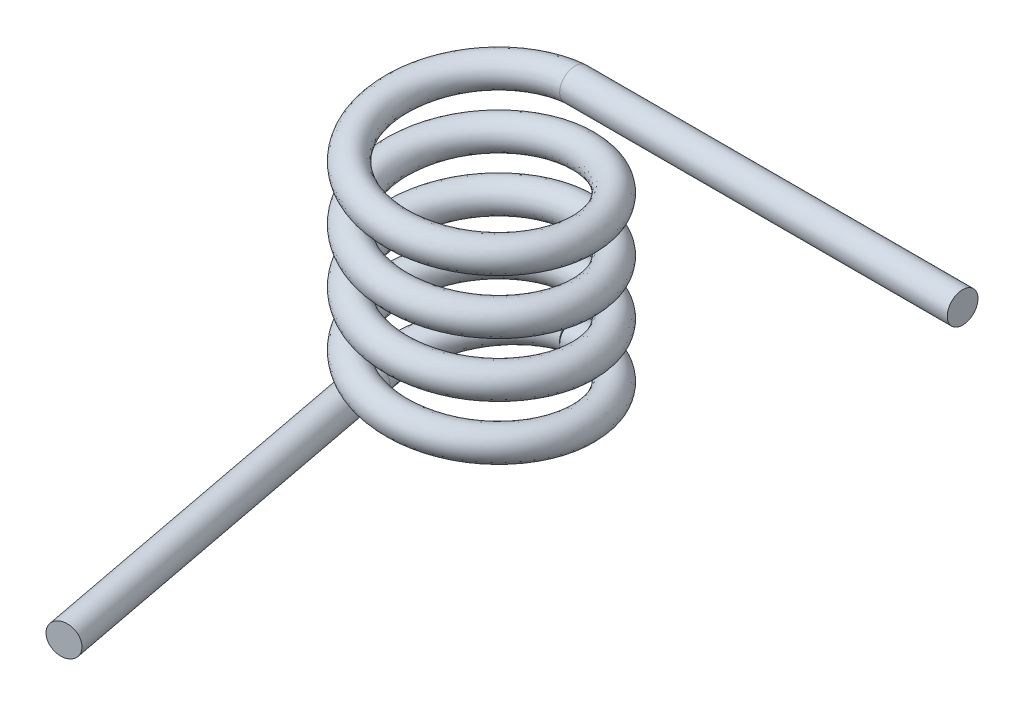
from build123d import *

# Parameters (mm, degrees)
SWEEP1_PITCH        = 1.125
SWEEP1_HEIGHT       = 4.5
SWEEP1_RADIUS       = 2
SWEEP1_START_ANGLE  = -180
SKETCH2_R           = 0.317499998
SWEEP3_PITCH        = 2.1875
SWEEP3_HEIGHT       = 0.6125
SWEEP3_RADIUS       = 2.25
SKETCH5_R           = 0.3175
SKETCH12_R          = 0.317499998
BOSS_EXTRUDE4_DEPTH = 8
SKETCH15_R          = 0.3175
BOSS_EXTRUDE7_DEPTH = 8


with BuildPart() as part:
    # Sweep1: sweep along a helix
    with BuildLine() as sweep1_path:
        add(Helix(SWEEP1_PITCH, SWEEP1_HEIGHT, SWEEP1_RADIUS, center=(0, 0, 0), direction=(0, 1, 0), lefthand=True, mode=Mode.PRIVATE).rotate(Axis((0, 0, 0), (0, 1, 0)), SWEEP1_START_ANGLE))
    # Sketch2 → Sweep1 (sweep)
    with BuildSketch(Plane(origin=(0, 0, 0), x_dir=(0, 0, -1), z_dir=(1, 0, 0))):
        with Locations((-1.93233569, 0.515828248)):
            Circle(SKETCH2_R)
    sweep(path=sweep1_path.line, is_frenet=True)

    # Sweep3: sweep along a helix
    with BuildLine() as sweep3_path:
        Helix(SWEEP3_PITCH, SWEEP3_HEIGHT, SWEEP3_RADIUS, center=(0, 0, 0), direction=(0, -1, 0), lefthand=True)
    # Sketch5 → Sweep3 (sweep)
    with BuildSketch(Plane.ZY):
        with Locations((-1.93, 0)):
            Circle(SKETCH5_R)
    sweep(path=sweep3_path.line, is_frenet=True)

    # Sketch12 → Boss-Extrude4 (add)
    with BuildSketch(Plane(origin=(0, 0, 0), x_dir=(0, 0, -1), z_dir=(1, 0, 0))):
        with Locations((1.93233569, 4.453328248)):
            Circle(SKETCH12_R)
    extrude(amount=BOSS_EXTRUDE4_DEPTH)

    # Sketch15 → Boss-Extrude7 (add)
    with BuildSketch(Plane(origin=(0, 0, 0), x_dir=(0.9823039508820723, 0, -0.18729374811101246), z_dir=(0.18729374811101246, 0, 0.9823039508820723))):
        with Locations(Location((-1.93, -0.613166674, 0), (0, 0, 180))):
            Circle(SKETCH15_R)
    extrude(amount=BOSS_EXTRUDE7_DEPTH)


solid = part.part
